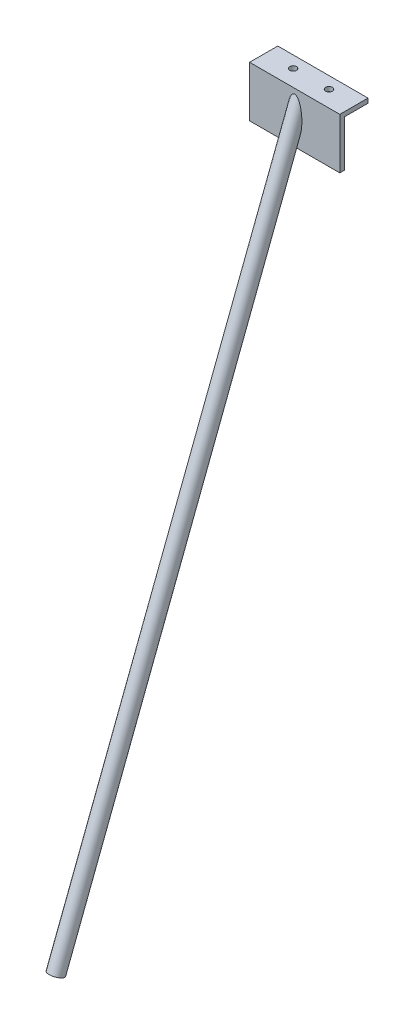
from build123d import *

# Parameters (mm, degrees)
BOSS_EXTRUDE1_DEPTH             = 80
BOSS_EXTRUDE2_REACH             = 99.687
SKETCH2_R                       = 6.375
SKETCH2_R_2                     = 4.9
BOSS_EXTRUDE2_DIRECTION_2_DEPTH = 570
F_6_0MM_DOWEL_HOLE1_D           = 6


with BuildPart() as part:
    # Sketch1 → Boss-Extrude1 (new body)
    with BuildSketch(Plane(origin=(0, 0, 0), x_dir=(0, 0, -1), z_dir=(1, 0, 0))):
        Polygon((0, 0), (25, 0), (25, -4), (4, -4), (4, -45), (0, -45), align=None)
    extrude(amount=BOSS_EXTRUDE1_DEPTH)

    # Boss-Extrude2: up to this plane
    boss_extrude2_end = Plane(origin=(80, -45, 0), z_dir=(0, 0, -1))
    # Sketch2 → Boss-Extrude2 (add, up to the surface)
    with BuildSketch(Plane(origin=(0, -39.220758573, 15.055438643), x_dir=(-1, 0, 0), z_dir=(0, 0.9335804264972002, -0.3583679495453042)), mode=Mode.PRIVATE) as boss_extrude2_sk1:
        with Locations((-40, -8)):
            Circle(SKETCH2_R)
        with Locations((-40, -8)):
            Circle(SKETCH2_R_2, mode=Mode.SUBTRACT)
    boss_extrude2_tool1 = split(extrude(boss_extrude2_sk1.sketch, amount=BOSS_EXTRUDE2_REACH, mode=Mode.PRIVATE), bisect_by=boss_extrude2_end, keep=Keep.BOTH, mode=Mode.PRIVATE)
    add(boss_extrude2_tool1.solids().sort_by_distance((46.194688, -42.087702, 7.586795))[0])

    # Sketch2 → Boss-Extrude2 direction 2 (add)
    with BuildSketch(Plane(origin=(0, -39.220758573, 15.055438643), x_dir=(-1, 0, 0), z_dir=(0, 0.9335804264972002, -0.3583679495453042))):
        with Locations((-40, -8)):
            Circle(SKETCH2_R)
        with Locations((-40, -8)):
            Circle(SKETCH2_R_2, mode=Mode.SUBTRACT)
    extrude(amount=-BOSS_EXTRUDE2_DIRECTION_2_DEPTH)

    # Ø6.0mm Dowel Hole1 (through all)
    with Locations(Plane(origin=(0, 0, 0), x_dir=(1, 0, 0), z_dir=(0, 1, 0))):
        with Locations((24.055, 14.5), (55.945, 14.5)):
            Hole(F_6_0MM_DOWEL_HOLE1_D / 2)


solid = part.part
